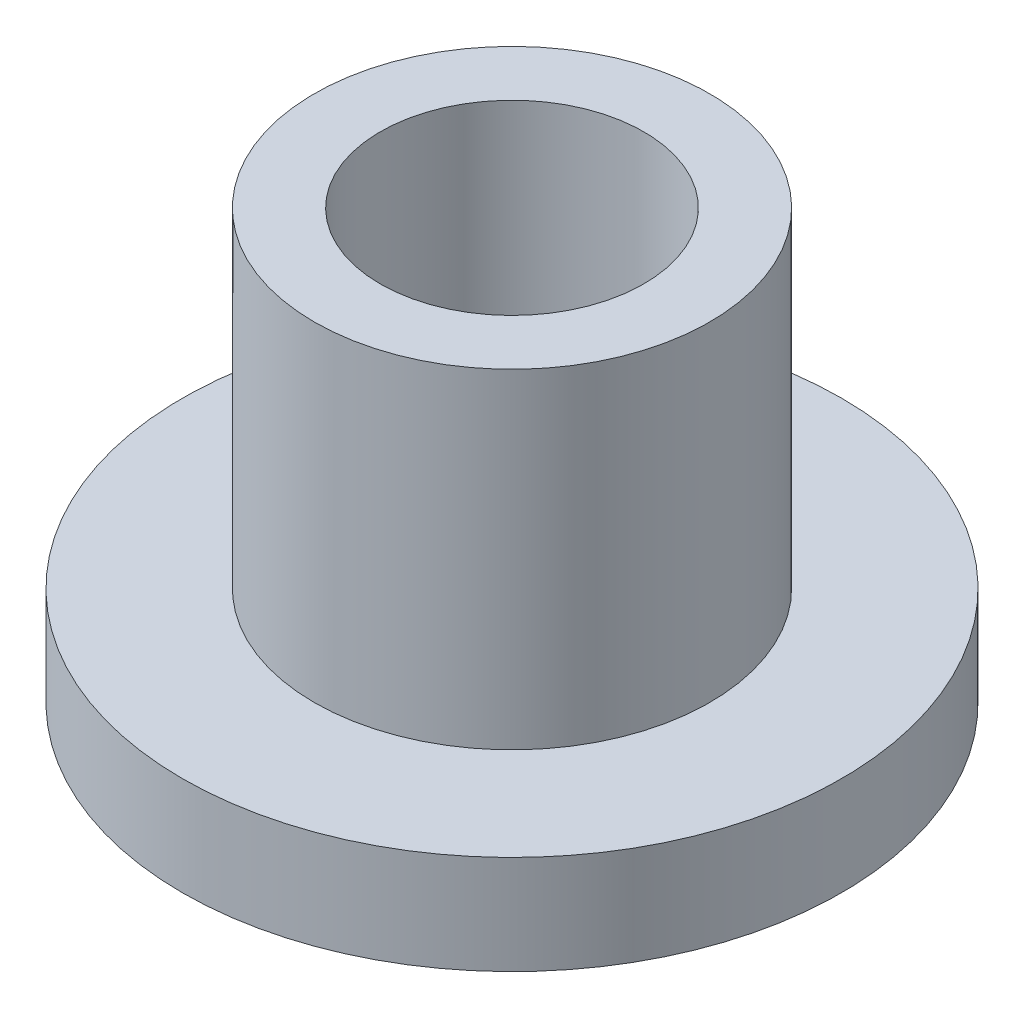
from build123d import *

# Parameters (mm, degrees)
SKETCH_1_R          = 20
EXTRUDE_1_DEPTH     = 6
SKETCH_2_R          = 12
EXTRUDE_2_DEPTH     = 20
SKETCH_3_R          = 8
CUT_EXTRUDE_3_DEPTH = 25


with BuildPart() as part:
    # Эскиз1 → Вытянуть1 (new body)
    with BuildSketch(Plane(origin=(0, 0, 0), x_dir=(1, 0, 0), z_dir=(0, 1, 0))):
        Circle(SKETCH_1_R)
    extrude(amount=EXTRUDE_1_DEPTH)

    # Эскиз2 → Вытянуть2 (add)
    with BuildSketch(Plane(origin=(0, 6, 0), x_dir=(1, 0, 0), z_dir=(0, 1, 0))):
        Circle(SKETCH_2_R)
    extrude(amount=EXTRUDE_2_DEPTH)

    # Эскиз3 → Вытянуть3 (cut)
    with BuildSketch(Plane(origin=(0, 26, 0), x_dir=(-1, 0, 0), z_dir=(0, 1, 0))):
        Circle(SKETCH_3_R)
    extrude(amount=-CUT_EXTRUDE_3_DEPTH, mode=Mode.SUBTRACT)


solid = part.part
